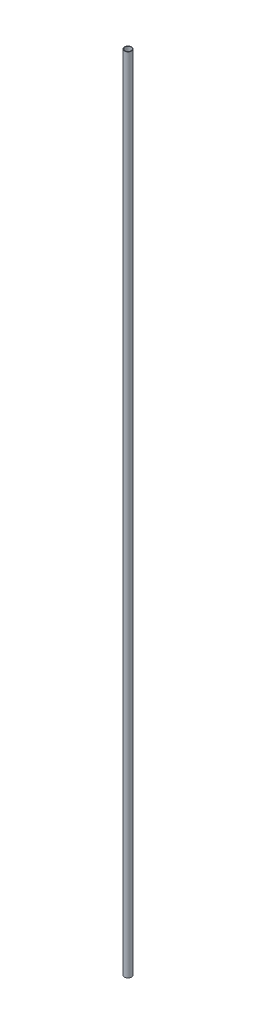
from build123d import *

# Parameters (mm, degrees)
SKETCH1_R           = 4
SKETCH1_R_2         = 3.5
BOSS_EXTRUDE1_DEPTH = 891.83


with BuildPart() as part:
    # Sketch1 → Boss-Extrude1 (new body)
    with BuildSketch(Plane(origin=(0, 0, 0), x_dir=(1, 0, 0), z_dir=(0, 1, 0))):
        Circle(SKETCH1_R)
        Circle(SKETCH1_R_2, mode=Mode.SUBTRACT)
    extrude(amount=BOSS_EXTRUDE1_DEPTH)


solid = part.part
